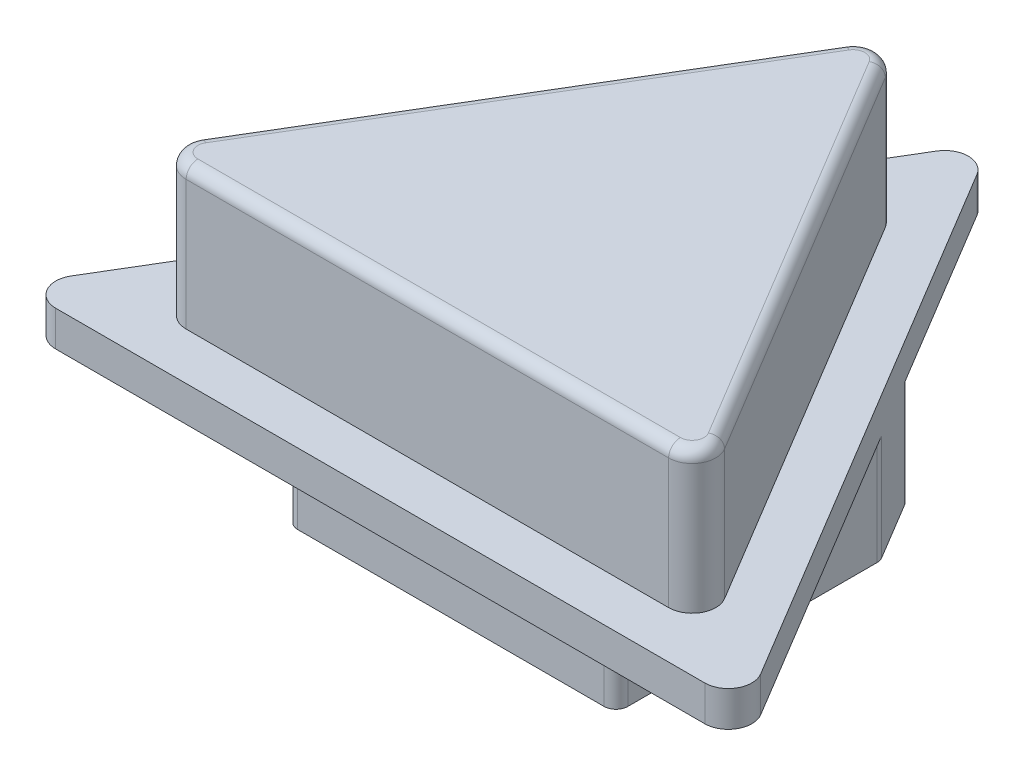
from build123d import *

# Parameters (mm, degrees)
BOSS_EXTRUDE1_DEPTH = 3
BOSS_EXTRUDE2_DEPTH = 0.75
BOSS_EXTRUDE3_DEPTH = 2.25
FILLET1_R           = 0.5
FILLET2_R           = 0.5
FILLET4_R           = 0.25
FILLET6_R           = 0.25


with BuildPart() as part:
    # Sketch1 → Boss-Extrude1 (new body)
    with BuildSketch(Plane(origin=(0, 0, 0), x_dir=(1, 0, 0), z_dir=(0, 1, 0))):
        Polygon((0, 0), (6, 10), (12, 2.4e-16), align=None)
    extrude(amount=BOSS_EXTRUDE1_DEPTH)

    # Sketch2 → Boss-Extrude2 (add)
    with BuildSketch(Plane.XZ):
        Polygon((13.766190378969059, 0.9999999999999998), (-1.7661903789690598, 1), (5.999999999999999, -11.943650631615101), align=None)
    extrude(amount=BOSS_EXTRUDE2_DEPTH)

    # Sketch3 → Boss-Extrude3 (add)
    with BuildSketch(Plane.XZ.offset(0.75)):
        Polygon((3.333809621030939, -7.5), (8.666190378969059, -7.5), (9.499999999999998, -6.1103172982817675), (9.499999999999998, -0.49999999999999883), (2.5, -0.49999999999999967), (2.5000000000000013, -6.11031729828177), align=None)
        Polygon((3.5, -1.4999999999999996), (8.499999999999998, -1.499999999999999), (8.5, -6.5), (3.500000000000001, -6.5), align=None, mode=Mode.SUBTRACT)
    extrude(amount=BOSS_EXTRUDE3_DEPTH)

    # Fillet1
    fillet1_edges = [part.edges().sort_by_distance(p)[0] for p in [
        (5.999999999999999, -0.375, -11.943650631615101),
        (-1.7661903789690598, -0.375, 1),
        (13.766190378969059, -0.375, 0.9999999999999998),
    ]]
    fillet(fillet1_edges, radius=FILLET1_R)

    # Fillet2
    fillet2_edges = [part.edges().sort_by_distance(p)[0] for p in [
        (0, 1.5, 0),
        (12, 1.5, -2.4e-16),
        (6, 1.5, -10),
    ]]
    fillet(fillet2_edges, radius=FILLET2_R)

    # Fillet4
    fillet4_edges = [part.edges().sort_by_distance(p)[0] for p in [
        (6.000000000000001, 3, -9.528174684192452),
        (8.987198868114007, 3, -5.021335219809989),
        (11.552004763892208, 3, -0.25365059250820254),
        (6, 3, -1.2e-16),
        (0.44799523610779024, 3, -0.2536505925082033),
        (3.0128011318859933, 3, -5.0213352198099885),
    ]]
    fillet(fillet4_edges, radius=FILLET4_R)

    # Fillet6
    fillet6_edges = [part.edges().sort_by_distance(p)[0] for p in [
        (2.5, -1.875, -0.49999999999999967),
        (2.5000000000000018, -1.875, -6.11031729828177),
        (3.333809621030939, -1.875, -7.499999999999999),
        (8.666190378969059, -1.875, -7.5),
        (9.5, -1.875, -6.1103172982817675),
        (9.499999999999998, -1.875, -0.49999999999999883),
    ]]
    fillet(fillet6_edges, radius=FILLET6_R)


solid = part.part
